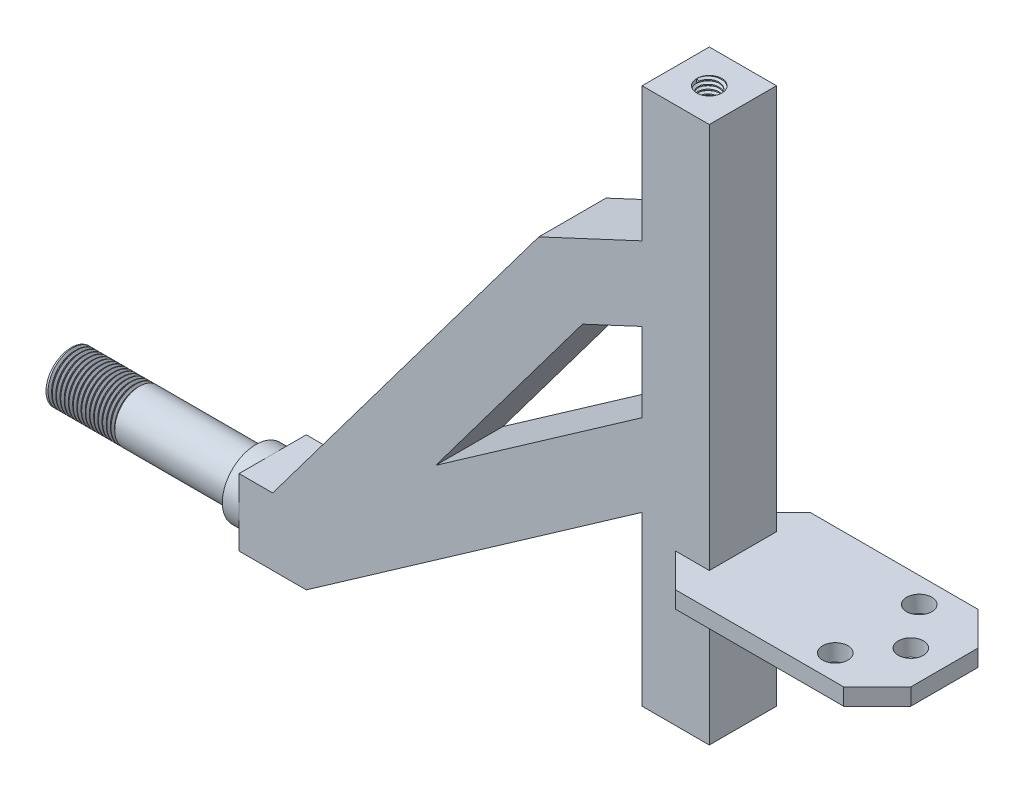
from build123d import *
from build123d.topology import SkipClean

# Parameters (mm, degrees)
SKETCH1_W                 = 25.4
SKETCH1_H                 = 25.4
SKETCH1_W_2               = 20.32
SKETCH1_H_2               = 20.32
SQ_TB_EXTRUDE_DEPTH       = 203.2
SKETCH3_W                 = 20.32
SKETCH3_H                 = 20.32
SKETCH3_R                 = 4.7625
END_CAPS_DEPTH            = 6.35
TOP_THREAD_PITCH          = 1.5875
BOTTOM_THREAD_PITCH       = 1.5875
SQ_TB_ANGLES_DEPTH        = 12.7
SQ_TB_ANGLES_DEPTH_BACK   = 12.7
WHEEL_THREADS_PITCH       = 1.5875
TIE_ROD_MOUNT_PLATE_DEPTH = 6.35
SKETCH16_R                = 4.7625
TIE_ROD_MOUNT_HOLE_DEPTH  = 284.198699609


with BuildPart() as part:
    # Sketch1 → Sq_Tb Extrude (new body)
    with BuildSketch(Plane(origin=(0, 0, 0), x_dir=(1, 0, 0), z_dir=(0, 1, 0))):
        Rectangle(SKETCH1_W, SKETCH1_H)
        Rectangle(SKETCH1_W_2, SKETCH1_H_2, mode=Mode.SUBTRACT)
    extrude(amount=SQ_TB_EXTRUDE_DEPTH)

    # Sketch3 → End Caps (add)
    with BuildSketch(Plane(origin=(0, 203.2, 0), x_dir=(1, 0, 0), z_dir=(0, 1, 0))):
        Rectangle(SKETCH3_W, SKETCH3_H)
        with Locations(Location((0, 0, 0), (0, 0, 270))):
            Circle(SKETCH3_R, mode=Mode.SUBTRACT)
    end_caps = extrude(amount=-END_CAPS_DEPTH)

    # End Cap Mirror: End Caps across plane
    add(end_caps.mirror(Plane.ZX.offset(101.6)))

    # Top Thread: the profile of Thread Profile1 profile screwed along a right-hand helix of 4 turns, 8 arcs to a turn; built about Z, then put on its axis
    with SkipClean():  # the faces are left unmerged after this step: merging them gives an invalid solid
        top_thread_z = Axis((0, 0, 0), (0, 0, 1))
        top_thread_corners = [(4.7628, 0, -0.000173205), (4.7628, 0, 1.389235701), (3.903240423, 0, 0.892968748), (3.903240423, 0, 0.496093748)]
        with BuildLine(mode=Mode.PRIVATE) as top_thread_profile:
            Line(top_thread_corners[0], top_thread_corners[1])
            Line(top_thread_corners[1], top_thread_corners[2])
            Line(top_thread_corners[2], top_thread_corners[3])
            Line(top_thread_corners[3], top_thread_corners[0])
        top_thread_cap = Face(top_thread_profile.wire())
        top_thread_turn_angles = [0, 22.5, 45, 67.5, 90, 112.5, 135, 157.5, 180, 202.5, 225, 247.5, 270, 292.5, 315, 337.5, 360]
        top_thread_turn_weights = [1, 0.9238795325112867, 1, 0.9238795325112867, 1, 0.9238795325112867, 1, 0.9238795325112867, 1, 0.9238795325112867, 1, 0.9238795325112867, 1, 0.9238795325112867, 1, 0.9238795325112867, 1]
        top_thread_turn_rails = [Edge.make_bspline([Vector(p[0], p[1], 0).rotate(top_thread_z, top_thread_turn_angles[k]) / top_thread_turn_weights[k] + Vector(0, 0, p[2] + TOP_THREAD_PITCH * top_thread_turn_angles[k] / 360) for k in range(17)], [0, 0, 0, 1, 1, 2, 2, 3, 3, 4, 4, 5, 5, 6, 6, 7, 7, 8, 8, 8], 2, top_thread_turn_weights) for p in top_thread_corners]
        top_thread_turn_sides = [Face.make_surface_from_curves(top_thread_turn_rails[p[0]], top_thread_turn_rails[p[1]]) for p in [(0, 1), (1, 2), (2, 3), (3, 0)]]
        top_thread = Plane(origin=(0, 203.2, 0), x_dir=(-1, 0, 0), z_dir=(0, -1, 0)) * Solid(Shell([*[p.moved(Location((0, 0, TOP_THREAD_PITCH * i))) for i in range(4) for p in top_thread_turn_sides], top_thread_cap, top_thread_cap.rotate(top_thread_z, 1440).moved(Location((0, 0, TOP_THREAD_PITCH * 1440 / 360)))]))
        add(top_thread)

    # Bottom Thread: the profile of Thread Profile2 profile screwed along a right-hand helix of 4 turns, 8 arcs to a turn; built about Z, then put on its axis
    with SkipClean():  # the faces are left unmerged after this step: merging them gives an invalid solid
        bottom_thread_z = Axis((0, 0, 0), (0, 0, 1))
        bottom_thread_corners = [(4.7628, 0, -0.000173205), (4.7628, 0, 1.389235701), (3.903240423, 0, 0.892968748), (3.903240423, 0, 0.496093748)]
        with BuildLine(mode=Mode.PRIVATE) as bottom_thread_profile:
            Line(bottom_thread_corners[0], bottom_thread_corners[1])
            Line(bottom_thread_corners[1], bottom_thread_corners[2])
            Line(bottom_thread_corners[2], bottom_thread_corners[3])
            Line(bottom_thread_corners[3], bottom_thread_corners[0])
        bottom_thread_cap = Face(bottom_thread_profile.wire())
        bottom_thread_turn_angles = [0, 22.5, 45, 67.5, 90, 112.5, 135, 157.5, 180, 202.5, 225, 247.5, 270, 292.5, 315, 337.5, 360]
        bottom_thread_turn_weights = [1, 0.9238795325112867, 1, 0.9238795325112867, 1, 0.9238795325112867, 1, 0.9238795325112867, 1, 0.9238795325112867, 1, 0.9238795325112867, 1, 0.9238795325112867, 1, 0.9238795325112867, 1]
        bottom_thread_turn_rails = [Edge.make_bspline([Vector(p[0], p[1], 0).rotate(bottom_thread_z, bottom_thread_turn_angles[k]) / bottom_thread_turn_weights[k] + Vector(0, 0, p[2] + BOTTOM_THREAD_PITCH * bottom_thread_turn_angles[k] / 360) for k in range(17)], [0, 0, 0, 1, 1, 2, 2, 3, 3, 4, 4, 5, 5, 6, 6, 7, 7, 8, 8, 8], 2, bottom_thread_turn_weights) for p in bottom_thread_corners]
        bottom_thread_turn_sides = [Face.make_surface_from_curves(bottom_thread_turn_rails[p[0]], bottom_thread_turn_rails[p[1]]) for p in [(0, 1), (1, 2), (2, 3), (3, 0)]]
        bottom_thread = Plane(origin=(0, 0, 0), x_dir=(1, 0, 0), z_dir=(0, 1, 0)) * Solid(Shell([*[p.moved(Location((0, 0, BOTTOM_THREAD_PITCH * i))) for i in range(4) for p in bottom_thread_turn_sides], bottom_thread_cap, bottom_thread_cap.rotate(bottom_thread_z, 1440).moved(Location((0, 0, BOTTOM_THREAD_PITCH * 1440 / 360)))]))
        add(bottom_thread)

    # Sketch9 → Sq_Tb Angles (add, two sides: drawn at the far end of the back side and taken through both)
    with SkipClean():  # the faces are left unmerged after this step: merging them gives an invalid solid
        with BuildSketch(Plane.XY.offset(-SQ_TB_ANGLES_DEPTH_BACK)):
            Polygon((-165.1, 0), (-152.4, 0), (-51.760742532, 134.185676624), (-12.7, 152.4), (-12.7, 124.374200858), (-35.258884973, 113.854820036), (-139.7, -25.4), (-165.1, -25.4), align=None)
            Polygon((-12.7, 94.504651264), (-90.745287478, 39.872950029), (-139.7, -25.4), (-12.7, 63.5), align=None)
        extrude(amount=SQ_TB_ANGLES_DEPTH + SQ_TB_ANGLES_DEPTH_BACK)

    # Sketch11 → Wheel Rod (revolve)
    with SkipClean():  # the faces are left unmerged after this step: merging them gives an invalid solid
        with BuildSketch(Plane.XY):
            Polygon((-165.1, -12.7), (-241.3, -12.7), (-241.3, -3.175), (-171.45, -3.175), (-171.45, 0), (-165.1, 0), align=None)
        revolve(axis=Axis((-165.1, -12.7, 0), (-1, 0, 0)))

    # Wheel Threads: the profile of Thread Profile3 profile screwed along a right-hand helix of 16 turns, 8 arcs to a turn; built about Z, then put on its axis
    with SkipClean():  # the faces are left unmerged after this step: merging them gives an invalid solid
        wheel_threads_z = Axis((0, 0, 0), (0, 0, 1))
        wheel_threads_corners = [(9.5253, 0, -0.000173205), (9.5253, 0, 1.389235701), (8.665740423, 0, 0.892968748), (8.665740423, 0, 0.496093748)]
        with BuildLine(mode=Mode.PRIVATE) as wheel_threads_profile:
            Line(wheel_threads_corners[0], wheel_threads_corners[1])
            Line(wheel_threads_corners[1], wheel_threads_corners[2])
            Line(wheel_threads_corners[2], wheel_threads_corners[3])
            Line(wheel_threads_corners[3], wheel_threads_corners[0])
        wheel_threads_cap = Face(wheel_threads_profile.wire())
        wheel_threads_turn_angles = [0, 22.5, 45, 67.5, 90, 112.5, 135, 157.5, 180, 202.5, 225, 247.5, 270, 292.5, 315, 337.5, 360]
        wheel_threads_turn_weights = [1, 0.9238795325112867, 1, 0.9238795325112867, 1, 0.9238795325112867, 1, 0.9238795325112867, 1, 0.9238795325112867, 1, 0.9238795325112867, 1, 0.9238795325112867, 1, 0.9238795325112867, 1]
        wheel_threads_turn_rails = [Edge.make_bspline([Vector(p[0], p[1], 0).rotate(wheel_threads_z, wheel_threads_turn_angles[k]) / wheel_threads_turn_weights[k] + Vector(0, 0, p[2] + WHEEL_THREADS_PITCH * wheel_threads_turn_angles[k] / 360) for k in range(17)], [0, 0, 0, 1, 1, 2, 2, 3, 3, 4, 4, 5, 5, 6, 6, 7, 7, 8, 8, 8], 2, wheel_threads_turn_weights) for p in wheel_threads_corners]
        wheel_threads_turn_sides = [Face.make_surface_from_curves(wheel_threads_turn_rails[p[0]], wheel_threads_turn_rails[p[1]]) for p in [(0, 1), (1, 2), (2, 3), (3, 0)]]
        wheel_threads = Plane(origin=(-241.3, -12.7, 0), x_dir=(0, 0, -1), z_dir=(1, 0, 0)) * Solid(Shell([*[p.moved(Location((0, 0, WHEEL_THREADS_PITCH * i))) for i in range(16) for p in wheel_threads_turn_sides], wheel_threads_cap, wheel_threads_cap.rotate(wheel_threads_z, 5760).moved(Location((0, 0, WHEEL_THREADS_PITCH * 5760 / 360)))]))
        add(wheel_threads, mode=Mode.SUBTRACT)

    # Sketch15 → Tie-Rod Mount Plate (add)
    with SkipClean():  # the faces are left unmerged after this step: merging them gives an invalid solid
        with BuildSketch(Plane(origin=(0, 50.8, 0), x_dir=(1, 0, 0), z_dir=(0, 1, 0))):
            Polygon((0, 12.7), (12.7, 25.4), (76.2, 25.4), (88.9, 12.7), (88.9, -12.7), (76.2, -25.4), (12.7, -25.4), (0, -12.7), (12.7, -12.7), (12.7, 12.7), align=None)
        extrude(amount=TIE_ROD_MOUNT_PLATE_DEPTH)

    # Sketch16 → Tie-Rod Mount Hole (cut, through all)
    with SkipClean():  # the faces are left unmerged after this step: merging them gives an invalid solid
        with BuildSketch(Plane(origin=(0, 57.15, 0), x_dir=(1, 0, 0), z_dir=(0, 1, 0))):
            with Locations(Location((63.5, 15.875, 0), (0, 0, 270))):
                Circle(SKETCH16_R)
            with Locations(Location((63.5, -15.875, 0), (0, 0, 90))):
                Circle(SKETCH16_R)
            with Locations(Location((76.2, 0, 0), (0, 0, 270))):
                Circle(SKETCH16_R)
        extrude(amount=-TIE_ROD_MOUNT_HOLE_DEPTH, mode=Mode.SUBTRACT)


solid = part.part
